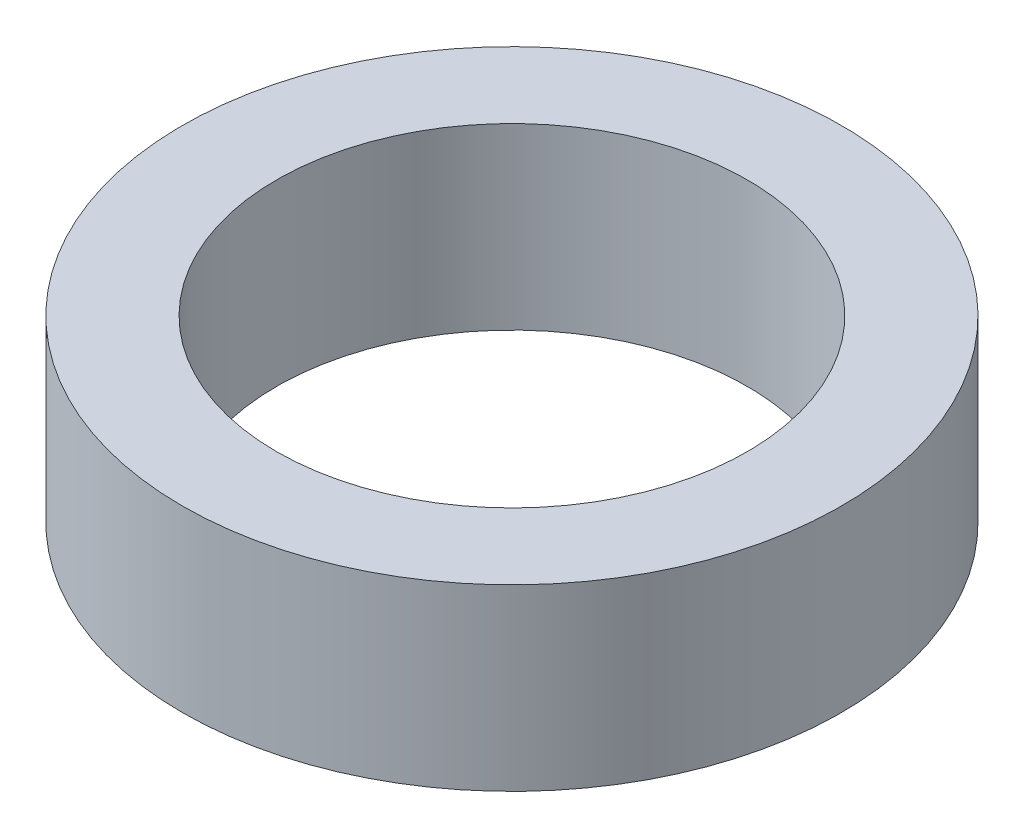
from build123d import *

# Parameters (mm, degrees)
SKETCH1_R           = 35
BOSS_EXTRUDE1_DEPTH = 19
SKETCH2_R           = 25
CUT_EXTRUDE1_DEPTH  = 54.018864567


with BuildPart() as part:
    # Sketch1 → Boss-Extrude1 (new body)
    with BuildSketch(Plane(origin=(0, 0, 0), x_dir=(1, 0, 0), z_dir=(0, 1, 0))):
        Circle(SKETCH1_R)
    extrude(amount=BOSS_EXTRUDE1_DEPTH)

    # Sketch2 → Cut-Extrude1 (cut, through all)
    with BuildSketch(Plane(origin=(0, 0, 0), x_dir=(1, 0, 0), z_dir=(0, 1, 0))):
        Circle(SKETCH2_R)
    extrude(amount=CUT_EXTRUDE1_DEPTH, mode=Mode.SUBTRACT)


solid = part.part
